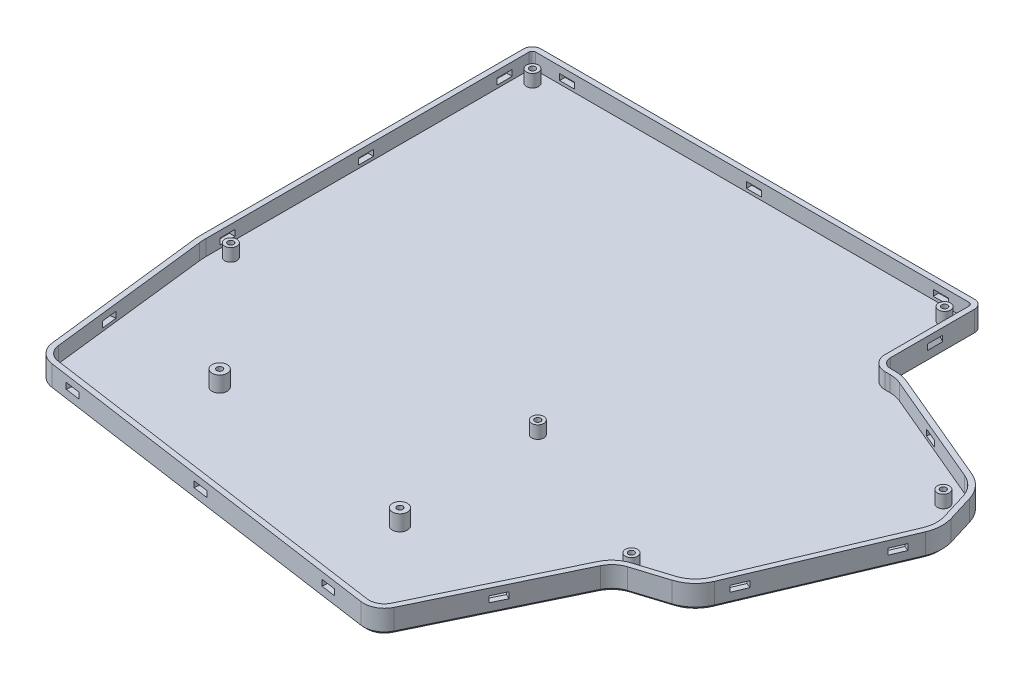
from build123d import *

# Parameters (mm, degrees)
EXTRUDE_1_DEPTH                 = 8
SHELL_1_T                       = -1.8
EXTRUDE_2_DEPTH                 = 2.8
CHAMFER_1_SIZE                  = 1.2
SKETCH_1_6_R                    = 2.5
EXTRUDE_3_DEPTH                 = 8
SKETCH_4_R                      = 2
EXTRUDE_4_DEPTH                 = 7
SKETCH_5_R                      = 2
CUT_EXTRUDE_2_DEPTH             = 1.8
SKETCH_6_R                      = 0.975
CUT_EXTRUDE_4_DEPTH             = 141.072245309
SKETCH_7_R                      = 0.975
CUT_EXTRUDE_5_DEPTH             = 5
OTHER_START                     = -73.595727744
OTHER_1_DEPTH                   = 5
OTHER_START_2                   = -23.595727744
OTHER_1_2_DEPTH                 = 5
OTHER_START_3                   = 26.404272256
OTHER_1_3_DEPTH                 = 5
OTHER_START_4                   = 37.760441006
OTHER_1_4_DEPTH                 = 5
OTHER_START_5                   = -85.913810652
OTHER_1_5_DEPTH                 = 5
OTHER_START_6                   = -80.913810652
OTHER_1_6_DEPTH                 = 5
OTHER_START_7                   = -39.913810652
OTHER_1_7_DEPTH                 = 5
OTHER_START_8                   = 6.086189348
OTHER_1_8_DEPTH                 = 5
OTHER_START_9                   = -92.32017293
OTHER_1_9_DEPTH                 = 5.004088406
OTHER_START_10                  = -30.32017293
OTHER_1_10_DEPTH                = 5.004088406
OTHER_START_11                  = 31.67982707
OTHER_1_11_DEPTH                = 5.004088406
OTHER_START_12                  = 45.029318989
OTHER_1_12_DEPTH                = 5
OTHER_START_13                  = 8.149122412
OTHER_1_13_DEPTH                = 5
OTHER_START_14                  = 48.149122412
OTHER_1_14_DEPTH                = 5
OTHER_START_15                  = -42.398480532
OTHER_1_15_DEPTH                = 5
CUT_EXTRUDE_1_REACH             = 229.09
SKETCH_6076_W                   = 5
SKETCH_6076_H                   = 2
CUT_EXTRUDE_1_DIRECTION_2_DEPTH = 228.090411107
CUT_EXTRUDE_2_2_REACH           = 234.851
SKETCH_9_W                      = 5
SKETCH_9_H                      = 2
CUT_EXTRUDE_3_REACH             = 218.543
SKETCH_10_W                     = 5
SKETCH_10_H                     = 2
CUT_EXTRUDE_4_2_REACH           = 211.505
SKETCH_11_W                     = 5
SKETCH_11_H                     = 2
CUT_EXTRUDE_5_2_REACH           = 225.549
SKETCH_12_W                     = 5
SKETCH_12_H                     = 2
CUT_EXTRUDE_6_REACH             = 213.991
SKETCH_13_W                     = 5
SKETCH_13_H                     = 2
CUT_EXTRUDE_7_REACH             = 217.265
SKETCH_14_W                     = 5.004088406
SKETCH_14_H                     = 2


# Read off the part's stored shape, not the designer's step: 型腔1
with BuildPart() as part:
    # 草图1 → 凸台-拉伸1 (new body)
    with BuildSketch(Plane(origin=(0, 0, 0), x_dir=(1, 0, 0), z_dir=(0, 1, 0))):
        with BuildLine():
            Line((-103.198547972, -15.620256198), (-103.198547972, 91.473161452))
            ThreePointArc((-103.198547972, 91.473161452), (-102.349157638, 93.523771117), (-100.298547972, 94.373161452))
            Line((-100.298547972, 94.373161452), (43.518152935, 94.373161452))
            ThreePointArc((43.518152935, 94.373161452), (45.5687626, 93.523771117), (46.418152935, 91.473161452))
            Line((46.418152935, 91.473161452), (46.418152935, 63.604205624))
            ThreePointArc((46.418152935, 63.604205624), (47.326121913, 61.412174602), (49.518152935, 60.504205624))
            Line((49.518152935, 60.504205624), (51.146615247, 60.504205624))
            ThreePointArc((51.146615247, 60.504205624), (53.506604914, 60.267843511), (55.772844642, 59.568146593))
            Line((55.772844642, 59.568146593), (93.262784098, 43.749285436))
            ThreePointArc((93.262784098, 43.749285436), (97.476797326, 40.751529899), (100.02124351, 36.249281642))
            Line((100.02124351, 36.249281642), (102.68323678, 27.50028781))
            ThreePointArc((102.68323678, 27.50028781), (103.182487219, 23.418298867), (102.262488942, 19.410121239))
            Line((102.262488942, 19.410121239), (81.487236613, -29.826226702))
            ThreePointArc((81.487236613, -29.826226702), (78.532968581, -34.000857461), (74.099321051, -36.549977144))
            Line((74.099321051, -36.549977144), (62.915226314, -40.073737319))
            ThreePointArc((62.915226314, -40.073737319), (60.047737989, -41.67537253), (58.051947414, -44.283924737))
            Line((58.051947414, -44.283924737), (35.803402586, -90.467786248))
            ThreePointArc((35.803402586, -90.467786248), (32.834391851, -93.561280846), (28.611436433, -94.303831252))
            Line((28.611436433, -94.303831252), (-91.020659667, -77.215820514))
            ThreePointArc((-91.020659667, -77.215820514), (-94.987916441, -75.199440178), (-96.898999439, -71.180400773))
            Line((-96.898999439, -71.180400773), (-103.052608483, -18.144310731))
            ThreePointArc((-103.052608483, -18.144310731), (-103.162032658, -16.88439124), (-103.198547972, -15.620256198))
        make_face()
    extrude(amount=EXTRUDE_1_DEPTH)

    # 抽壳1
    shell_1_openings = [part.faces().sort_by_distance(p)[0] for p in [
        (-12.989153161, 8, -5.543166959),
    ]]
    offset(amount=SHELL_1_T, openings=shell_1_openings, kind=Kind.INTERSECTION)

    # 草图1<5> → 凸台-拉伸2 (add)
    with BuildSketch(Plane(origin=(0, 0, 0), x_dir=(1, 0, 0), z_dir=(0, 1, 0))):
        with BuildLine():
            Line((-103.198547972, -15.620256198), (-103.198547972, 91.473161452))
            ThreePointArc((-103.198547972, 91.473161452), (-102.349157638, 93.523771117), (-100.298547972, 94.373161452))
            Line((-100.298547972, 94.373161452), (43.518152935, 94.373161452))
            ThreePointArc((43.518152935, 94.373161452), (45.5687626, 93.523771117), (46.418152935, 91.473161452))
            Line((46.418152935, 91.473161452), (46.418152935, 63.604205624))
            ThreePointArc((46.418152935, 63.604205624), (47.326121913, 61.412174602), (49.518152935, 60.504205624))
            Line((49.518152935, 60.504205624), (51.146615247, 60.504205624))
            ThreePointArc((51.146615247, 60.504205624), (53.506604914, 60.267843511), (55.772844642, 59.568146593))
            Line((55.772844642, 59.568146593), (93.262784098, 43.749285436))
            ThreePointArc((93.262784098, 43.749285436), (97.476797326, 40.751529899), (100.02124351, 36.249281642))
            Line((100.02124351, 36.249281642), (102.68323678, 27.50028781))
            ThreePointArc((102.68323678, 27.50028781), (103.182487219, 23.418298867), (102.262488942, 19.410121239))
            Line((102.262488942, 19.410121239), (81.487236613, -29.826226702))
            ThreePointArc((81.487236613, -29.826226702), (78.532968581, -34.000857461), (74.099321051, -36.549977144))
            Line((74.099321051, -36.549977144), (62.915226314, -40.073737319))
            ThreePointArc((62.915226314, -40.073737319), (60.047737989, -41.67537253), (58.051947414, -44.283924737))
            Line((58.051947414, -44.283924737), (35.803402586, -90.467786248))
            ThreePointArc((35.803402586, -90.467786248), (32.834391851, -93.561280846), (28.611436433, -94.303831252))
            Line((28.611436433, -94.303831252), (-91.020659667, -77.215820514))
            ThreePointArc((-91.020659667, -77.215820514), (-94.987916441, -75.199440178), (-96.898999439, -71.180400773))
            Line((-96.898999439, -71.180400773), (-103.052608483, -18.144310731))
            ThreePointArc((-103.052608483, -18.144310731), (-103.162032658, -16.88439124), (-103.198547972, -15.620256198))
        make_face()
    extrude(amount=EXTRUDE_2_DEPTH)

    # 倒角1
    chamfer_1_edges = [part.edges().sort_by_distance(p)[0] for p in [
        (46.927675, 0, 67.375855493),
        (60.047737989, 0, 41.67537253),
        (68.507273682, 0, 38.311857231),
        (101.352240145, 0, -31.874784726),
        (53.506604914, 0, -60.267843511),
        (46.418152935, 0, -77.538683538),
        (45.5687626, 0, -93.523771117),
        (-103.162032658, 0, 16.88439124),
        (32.834391851, 0, 93.561280846),
        (-99.975803961, 0, 44.662355752),
        (-94.987916441, 0, 75.199440178),
        (-31.204611617, 0, 85.759825883),
        (-103.198547972, 0, -37.926452627),
        (-102.349157638, 0, -93.523771117),
        (-28.390197519, 0, -94.373161452),
        (47.326121913, 0, -61.412174602),
        (50.332384091, 0, -60.504205624),
        (74.51781437, 0, -51.658716014),
        (97.476797326, 0, -40.751529899),
        (103.182487219, 0, -23.418298867),
        (91.874862778, 0, 5.208052732),
        (78.532968581, 0, 34.000857461),
    ]]
    chamfer(chamfer_1_edges, length=CHAMFER_1_SIZE)

    # 草图1<6> → 凸台-拉伸3 (add)
    with BuildSketch(Plane(origin=(0, 0, 0), x_dir=(1, 0, 0), z_dir=(0, 1, 0))):
        with Locations(Location((-61.66065098, -50.898976671, 0), (0, 0, 90))):
            Circle(SKETCH_1_6_R)
        with Locations(Location((8.133002281, -60.868163329, 0), (0, 0, 90))):
            Circle(SKETCH_1_6_R)
    extrude(amount=EXTRUDE_3_DEPTH)

    # 草图4 → 凸台-拉伸4 (add)
    with BuildSketch(Plane(origin=(0, 0, 0), x_dir=(1, 0, 0), z_dir=(0, 1, 0))):
        with Locations(Location((4.796495735, -11.776067612, 0), (0, 0, 90))):
            Circle(SKETCH_4_R)
        with Locations(Location((58.49137047, -34.404776747, 0), (0, 0, 90))):
            Circle(SKETCH_4_R)
        with Locations(Location((-97.077191421, -11.776067612, 0), (0, 0, 90))):
            Circle(SKETCH_4_R)
        with Locations(Location((-97.077191421, 88.328252795, 0), (0, 0, 90))):
            Circle(SKETCH_4_R)
        with Locations(Location((39.691476535, 88.328252795, 0), (0, 0, 90))):
            Circle(SKETCH_4_R)
        with Locations(Location((92.011556645, 35.568345732, 0), (0, 0, 90))):
            Circle(SKETCH_4_R)
    extrude(amount=EXTRUDE_4_DEPTH)

    # 草图5 → Cut-Extrude 2 (cut)
    with BuildSketch(Plane(origin=(0, 0, 0), x_dir=(1, 0, 0), z_dir=(0, 1, 0))):
        with Locations(Location((-61.66065098, -50.898976671, 0), (0, 0, 270))):
            Circle(SKETCH_5_R)
        with Locations(Location((8.133002281, -60.868163329, 0), (0, 0, 270))):
            Circle(SKETCH_5_R)
    extrude(amount=CUT_EXTRUDE_2_DEPTH, mode=Mode.SUBTRACT)

    # 草图6 → Cut-Extrude 4 (cut, through all)
    with BuildSketch(Plane(origin=(0, 8, 0), x_dir=(1, 0, 0), z_dir=(0, 1, 0))):
        with Locations(Location((8.133002281, -60.868163329, 0), (0, 0, 270))):
            Circle(SKETCH_6_R)
        with Locations(Location((-61.66065098, -50.898976671, 0), (0, 0, 270))):
            Circle(SKETCH_6_R)
    extrude(amount=-CUT_EXTRUDE_4_DEPTH, mode=Mode.SUBTRACT)

    # 草图7 → Cut-Extrude 5 (cut)
    with BuildSketch(Plane(origin=(0, 7, 0), x_dir=(1, 0, 0), z_dir=(0, 1, 0))):
        with Locations(Location((-97.077191421, -11.776067612, 0), (0, 0, 270))):
            Circle(SKETCH_7_R)
        with Locations(Location((4.796495735, -11.776067612, 0), (0, 0, 270))):
            Circle(SKETCH_7_R)
        with Locations(Location((58.49137047, -34.404776747, 0), (0, 0, 270))):
            Circle(SKETCH_7_R)
        with Locations(Location((92.011556645, 35.568345732, 0), (0, 0, 270))):
            Circle(SKETCH_7_R)
        with Locations(Location((39.691476535, 88.328252795, 0), (0, 0, 270))):
            Circle(SKETCH_7_R)
        with Locations(Location((-97.077191421, 88.328252795, 0), (0, 0, 270))):
            Circle(SKETCH_7_R)
    extrude(amount=-CUT_EXTRUDE_5_DEPTH, mode=Mode.SUBTRACT)

    # 型腔1 outline → 型腔1 (cut)
    with BuildSketch(Plane(origin=(0, 0, 0), x_dir=(0, 1, 0), z_dir=(0.9899521449428842, 0, 0.14140279602250802)).offset(OTHER_START)):
        with BuildLine():
            ThreePointArc((5.312591486, 88.200469726), (5.629956619, 88.164339398), (5.8, 88.434730369))
            Line((5.8, 88.434730369), (5.8, 89.310542914))
            Line((5.8, 89.310542914), (3.925, 89.310542914))
            Line((3.925, 89.310542914), (5.312591486, 88.200469726))
        make_face()
    extrude(amount=OTHER_1_DEPTH, mode=Mode.SUBTRACT)

    # Other 1 2 outline → Other 1 2 (cut)
    with BuildSketch(Plane(origin=(0, 0, 0), x_dir=(0, 1, 0), z_dir=(0.9899521449428842, 0, 0.14140279602250802)).offset(OTHER_START_2)):
        with BuildLine():
            ThreePointArc((5.312591486, 88.200469726), (5.629956619, 88.164339398), (5.8, 88.434730369))
            Line((5.8, 88.434730369), (5.8, 89.310542914))
            Line((5.8, 89.310542914), (3.925, 89.310542914))
            Line((3.925, 89.310542914), (5.312591486, 88.200469726))
        make_face()
    extrude(amount=OTHER_1_2_DEPTH, mode=Mode.SUBTRACT)

    # Other 1 3 outline → Other 1 3 (cut)
    with BuildSketch(Plane(origin=(0, 0, 0), x_dir=(0, 1, 0), z_dir=(0.9899521449428842, 0, 0.14140279602250802)).offset(OTHER_START_3)):
        with BuildLine():
            ThreePointArc((5.312591486, 88.200469726), (5.629956619, 88.164339398), (5.8, 88.434730369))
            Line((5.8, 88.434730369), (5.8, 89.310542914))
            Line((5.8, 89.310542914), (3.925, 89.310542914))
            Line((3.925, 89.310542914), (5.312591486, 88.200469726))
        make_face()
    extrude(amount=OTHER_1_3_DEPTH, mode=Mode.SUBTRACT)

    # Other 1 4 outline → Other 1 4 (cut)
    with BuildSketch(Plane(origin=(0, 0, 0), x_dir=(0.9933360963882286, 0, -0.11525363166597408), z_dir=(0.11525363166597406, 0, 0.9933360963882285)).offset(OTHER_START_4)):
        with BuildLine():
            Line((-103.581260994, 5.8), (-104.457073539, 5.8))
            Line((-104.457073539, 5.8), (-104.457073539, 3.925))
            Line((-104.457073539, 3.925), (-103.347000351, 5.312591486))
            ThreePointArc((-103.347000351, 5.312591486), (-103.310870023, 5.629956619), (-103.581260994, 5.8))
        make_face()
    extrude(amount=OTHER_1_4_DEPTH, mode=Mode.SUBTRACT)

    # Other 1 5 outline → Other 1 5 (cut)
    with BuildSketch(Plane.XY.offset(OTHER_START_5)):
        with BuildLine():
            Line((-102.322735427, 5.8), (-103.198547972, 5.8))
            Line((-103.198547972, 5.8), (-103.198547972, 3.925))
            Line((-103.198547972, 3.925), (-102.088474784, 5.312591486))
            ThreePointArc((-102.088474784, 5.312591486), (-102.052344456, 5.629956619), (-102.322735427, 5.8))
        make_face()
    extrude(amount=OTHER_1_5_DEPTH, mode=Mode.SUBTRACT)

    # Other 1 6 outline → Other 1 6 (cut)
    with BuildSketch(Plane.XY.offset(OTHER_START_6)):
        with BuildLine():
            Line((46.418152935, 5.8), (45.542340389, 5.8))
            ThreePointArc((45.542340389, 5.8), (45.271949418, 5.629956619), (45.308079746, 5.312591486))
            Line((45.308079746, 5.312591486), (46.418152935, 3.925))
            Line((46.418152935, 3.925), (46.418152935, 5.8))
        make_face()
    extrude(amount=OTHER_1_6_DEPTH, mode=Mode.SUBTRACT)

    # Other 1 7 outline → Other 1 7 (cut)
    with BuildSketch(Plane.XY.offset(OTHER_START_7)):
        with BuildLine():
            Line((-102.322735427, 5.8), (-103.198547972, 5.8))
            Line((-103.198547972, 5.8), (-103.198547972, 3.925))
            Line((-103.198547972, 3.925), (-102.088474784, 5.312591486))
            ThreePointArc((-102.088474784, 5.312591486), (-102.052344456, 5.629956619), (-102.322735427, 5.8))
        make_face()
    extrude(amount=OTHER_1_7_DEPTH, mode=Mode.SUBTRACT)

    # Other 1 8 outline → Other 1 8 (cut)
    with BuildSketch(Plane.XY.offset(OTHER_START_8)):
        with BuildLine():
            Line((-102.322735427, 5.8), (-103.198547972, 5.8))
            Line((-103.198547972, 5.8), (-103.198547972, 3.925))
            Line((-103.198547972, 3.925), (-102.088474784, 5.312591486))
            ThreePointArc((-102.088474784, 5.312591486), (-102.052344456, 5.629956619), (-102.322735427, 5.8))
        make_face()
    extrude(amount=OTHER_1_8_DEPTH, mode=Mode.SUBTRACT)

    # Other 1 9 outline → Other 1 9 (cut)
    with BuildSketch(Plane.YZ.offset(OTHER_START_9)):
        with BuildLine():
            Line((5.8, -94.373161452), (5.8, -93.497348906))
            ThreePointArc((5.8, -93.497348906), (5.629956619, -93.226957935), (5.312591486, -93.263088263))
            Line((5.312591486, -93.263088263), (3.925, -94.373161452))
            Line((3.925, -94.373161452), (5.8, -94.373161452))
        make_face()
    extrude(amount=OTHER_1_9_DEPTH, mode=Mode.SUBTRACT)

    # Other 1 10 outline → Other 1 10 (cut)
    with BuildSketch(Plane.YZ.offset(OTHER_START_10)):
        with BuildLine():
            Line((5.8, -94.373161452), (5.8, -93.497348906))
            ThreePointArc((5.8, -93.497348906), (5.629956619, -93.226957935), (5.312591486, -93.263088263))
            Line((5.312591486, -93.263088263), (3.925, -94.373161452))
            Line((3.925, -94.373161452), (5.8, -94.373161452))
        make_face()
    extrude(amount=OTHER_1_10_DEPTH, mode=Mode.SUBTRACT)

    # Other 1 11 outline → Other 1 11 (cut)
    with BuildSketch(Plane.YZ.offset(OTHER_START_11)):
        with BuildLine():
            Line((5.8, -94.373161452), (5.8, -93.497348906))
            ThreePointArc((5.8, -93.497348906), (5.629956619, -93.226957935), (5.312591486, -93.263088263))
            Line((5.312591486, -93.263088263), (3.925, -94.373161452))
            Line((3.925, -94.373161452), (5.8, -94.373161452))
        make_face()
    extrude(amount=OTHER_1_11_DEPTH, mode=Mode.SUBTRACT)

    # Other 1 12 outline → Other 1 12 (cut)
    with BuildSketch(Plane(origin=(0, 0, 0), x_dir=(0, 1, 0), z_dir=(0.92133957727179, 0, 0.388758772701838)).offset(OTHER_START_12)):
        with BuildLine():
            Line((5.8, -76.564673634), (5.8, -75.688861088))
            ThreePointArc((5.8, -75.688861088), (5.629956619, -75.418470117), (5.312591486, -75.454600445))
            Line((5.312591486, -75.454600445), (3.925, -76.564673634))
            Line((3.925, -76.564673634), (5.8, -76.564673634))
        make_face()
    extrude(amount=OTHER_1_12_DEPTH, mode=Mode.SUBTRACT)

    # Other 1 13 outline → Other 1 13 (cut)
    with BuildSketch(Plane(origin=(0, 0, 0), x_dir=(0.9213395772717908, 0, 0.388758772701836), z_dir=(0.38875877270183595, 0, -0.9213395772717909)).offset(OTHER_START_13)):
        with BuildLine():
            Line((85.796810876, -5.8), (86.672623422, -5.8))
            Line((86.672623422, -5.8), (86.672623422, -3.925))
            Line((86.672623422, -3.925), (85.562550233, -5.312591486))
            ThreePointArc((85.562550233, -5.312591486), (85.526419905, -5.629956619), (85.796810876, -5.8))
        make_face()
    extrude(amount=OTHER_1_13_DEPTH, mode=Mode.SUBTRACT)

    # Other 1 14 outline → Other 1 14 (cut)
    with BuildSketch(Plane(origin=(0, 0, 0), x_dir=(0.9213395772717908, 0, 0.388758772701836), z_dir=(0.38875877270183595, 0, -0.9213395772717909)).offset(OTHER_START_14)):
        with BuildLine():
            Line((85.796810876, -5.8), (86.672623422, -5.8))
            Line((86.672623422, -5.8), (86.672623422, -3.925))
            Line((86.672623422, -3.925), (85.562550233, -5.312591486))
            ThreePointArc((85.562550233, -5.312591486), (85.526419905, -5.629956619), (85.796810876, -5.8))
        make_face()
    extrude(amount=OTHER_1_14_DEPTH, mode=Mode.SUBTRACT)

    # Other 1 15 outline → Other 1 15 (cut)
    with BuildSketch(Plane(origin=(0, 0, 0), x_dir=(0.9009111391652838, 0, 0.43400359368087105), z_dir=(0.434003593680871, 0, -0.900911139165284)).offset(OTHER_START_15)):
        with BuildLine():
            Line((70.643216008, -5.8), (71.519028554, -5.8))
            Line((71.519028554, -5.8), (71.519028554, -3.925))
            Line((71.519028554, -3.925), (70.408955365, -5.312591486))
            ThreePointArc((70.408955365, -5.312591486), (70.372825037, -5.629956619), (70.643216008, -5.8))
        make_face()
    extrude(amount=OTHER_1_15_DEPTH, mode=Mode.SUBTRACT)

    # Sketch 6076 → 卡扣槽1 (cut, up to next)
    with BuildSketch(Plane.ZY.offset(103.198547972), mode=Mode.PRIVATE) as cut_extrude_1_sk1:
        with Locations((-83.413810652, 4.8)):
            Rectangle(SKETCH_6076_W, SKETCH_6076_H)
    cut_extrude_1_tool1 = extrude(cut_extrude_1_sk1.sketch, amount=-CUT_EXTRUDE_1_REACH, mode=Mode.PRIVATE) & part.part
    # Sketch 6076 → 卡扣槽1 (cut, up to next)
    with BuildSketch(Plane.ZY.offset(103.198547972), mode=Mode.PRIVATE) as cut_extrude_1_sk2:
        with Locations((-37.413810652, 4.8)):
            Rectangle(SKETCH_6076_W, SKETCH_6076_H)
    cut_extrude_1_tool2 = extrude(cut_extrude_1_sk2.sketch, amount=-CUT_EXTRUDE_1_REACH, mode=Mode.PRIVATE) & part.part
    # Sketch 6076 → 卡扣槽1 (cut, up to next)
    with BuildSketch(Plane.ZY.offset(103.198547972), mode=Mode.PRIVATE) as cut_extrude_1_sk3:
        with Locations((8.586189348, 4.8)):
            Rectangle(SKETCH_6076_W, SKETCH_6076_H)
    cut_extrude_1_tool3 = extrude(cut_extrude_1_sk3.sketch, amount=-CUT_EXTRUDE_1_REACH, mode=Mode.PRIVATE) & part.part
    add(cut_extrude_1_tool1.solids().sort_by_distance((-103.198548, 4.8, -83.413811))[0], mode=Mode.SUBTRACT)
    add(cut_extrude_1_tool2.solids().sort_by_distance((-103.198548, 4.8, -37.413811))[0], mode=Mode.SUBTRACT)
    add(cut_extrude_1_tool3.solids().sort_by_distance((-103.198548, 4.8, 8.586189))[0], mode=Mode.SUBTRACT)

    # Sketch 6076 → 卡扣槽1 direction 2 (cut)
    with BuildSketch(Plane.ZY.offset(103.198547972)):
        with Locations((-83.413810652, 4.8)):
            Rectangle(SKETCH_6076_W, SKETCH_6076_H)
        with Locations((-37.413810652, 4.8)):
            Rectangle(SKETCH_6076_W, SKETCH_6076_H)
        with Locations((8.586189348, 4.8)):
            Rectangle(SKETCH_6076_W, SKETCH_6076_H)
    extrude(amount=CUT_EXTRUDE_1_DIRECTION_2_DEPTH, mode=Mode.SUBTRACT)

    # 草图9 → Cut-Extrude 2 2 (cut, up to next)
    with BuildSketch(Plane(origin=(-103.76098167, 0, 12.039057079), x_dir=(0.11525363166597431, 0, 0.9933360963882285), z_dir=(-0.9933360963882285, 0, 0.11525363166597431)), mode=Mode.PRIVATE) as cut_extrude_2_2_sk1:
        with Locations((40.260441006, 4.8)):
            Rectangle(SKETCH_9_W, SKETCH_9_H)
    cut_extrude_2_2_tool1 = extrude(cut_extrude_2_2_sk1.sketch, amount=-CUT_EXTRUDE_2_2_REACH, mode=Mode.PRIVATE) & part.part
    add(cut_extrude_2_2_tool1.solids().sort_by_distance((-99.12082, 4.8, 52.031206))[0], mode=Mode.SUBTRACT)

    # 草图10 → 卡扣槽3 (cut, up to next)
    with BuildSketch(Plane(origin=(-12.628760482, 0, 88.413163524), x_dir=(0.9899521449428836, 0, 0.1414027960225113), z_dir=(-0.1414027960225113, 0, 0.9899521449428836)), mode=Mode.PRIVATE) as cut_extrude_3_sk1:
        with Locations((-71.095727744, 4.8)):
            Rectangle(SKETCH_10_W, SKETCH_10_H)
    cut_extrude_3_tool1 = extrude(cut_extrude_3_sk1.sketch, amount=-CUT_EXTRUDE_3_REACH, mode=Mode.PRIVATE) & part.part
    # 草图10 → 卡扣槽3 (cut, up to next)
    with BuildSketch(Plane(origin=(-12.628760482, 0, 88.413163524), x_dir=(0.9899521449428836, 0, 0.1414027960225113), z_dir=(-0.1414027960225113, 0, 0.9899521449428836)), mode=Mode.PRIVATE) as cut_extrude_3_sk2:
        with Locations((-21.095727744, 4.8)):
            Rectangle(SKETCH_10_W, SKETCH_10_H)
    cut_extrude_3_tool2 = extrude(cut_extrude_3_sk2.sketch, amount=-CUT_EXTRUDE_3_REACH, mode=Mode.PRIVATE) & part.part
    # 草图10 → 卡扣槽3 (cut, up to next)
    with BuildSketch(Plane(origin=(-12.628760482, 0, 88.413163524), x_dir=(0.9899521449428836, 0, 0.1414027960225113), z_dir=(-0.1414027960225113, 0, 0.9899521449428836)), mode=Mode.PRIVATE) as cut_extrude_3_sk3:
        with Locations((28.904272256, 4.8)):
            Rectangle(SKETCH_10_W, SKETCH_10_H)
    cut_extrude_3_tool3 = extrude(cut_extrude_3_sk3.sketch, amount=-CUT_EXTRUDE_3_REACH, mode=Mode.PRIVATE) & part.part
    add(cut_extrude_3_tool1.solids().sort_by_distance((-83.010129, 4.8, 78.360029))[0], mode=Mode.SUBTRACT)
    add(cut_extrude_3_tool2.solids().sort_by_distance((-33.512521, 4.8, 85.430169))[0], mode=Mode.SUBTRACT)
    add(cut_extrude_3_tool3.solids().sort_by_distance((15.985086, 4.8, 92.500308))[0], mode=Mode.SUBTRACT)

    # 草图11 → Cut-Extrude 4 2 (cut, up to next)
    with BuildSketch(Plane(origin=(64.432289486, 0, 31.039515409), x_dir=(0.43400359368087543, 0, -0.9009111391652818), z_dir=(0.9009111391652818, 0, 0.43400359368087543)), mode=Mode.PRIVATE) as cut_extrude_4_2_sk1:
        with Locations((-39.898480532, 4.8)):
            Rectangle(SKETCH_11_W, SKETCH_11_H)
    cut_extrude_4_2_tool1 = extrude(cut_extrude_4_2_sk1.sketch, amount=-CUT_EXTRUDE_4_2_REACH, mode=Mode.PRIVATE) & part.part
    add(cut_extrude_4_2_tool1.solids().sort_by_distance((47.116206, 4.8, 66.984501))[0], mode=Mode.SUBTRACT)

    # 草图12 → Cut-Extrude 5 2 (cut, up to next)
    with BuildSketch(Plane(origin=(79.854918224, 0, 33.694742708), x_dir=(0.38875877270183823, 0, -0.92133957727179), z_dir=(0.9213395772717898, 0, 0.3887587727018382)), mode=Mode.PRIVATE) as cut_extrude_5_2_sk1:
        with Locations((10.649122412, 4.8)):
            Rectangle(SKETCH_12_W, SKETCH_12_H)
    cut_extrude_5_2_tool1 = extrude(cut_extrude_5_2_sk1.sketch, amount=-CUT_EXTRUDE_5_2_REACH, mode=Mode.PRIVATE) & part.part
    # 草图12 → Cut-Extrude 5 2 (cut, up to next)
    with BuildSketch(Plane(origin=(79.854918224, 0, 33.694742708), x_dir=(0.38875877270183823, 0, -0.92133957727179), z_dir=(0.9213395772717898, 0, 0.3887587727018382)), mode=Mode.PRIVATE) as cut_extrude_5_2_sk2:
        with Locations((50.649122412, 4.8)):
            Rectangle(SKETCH_12_W, SKETCH_12_H)
    cut_extrude_5_2_tool2 = extrude(cut_extrude_5_2_sk2.sketch, amount=-CUT_EXTRUDE_5_2_REACH, mode=Mode.PRIVATE) & part.part
    add(cut_extrude_5_2_tool1.solids().sort_by_distance((83.994858, 4.8, 23.883285))[0], mode=Mode.SUBTRACT)
    add(cut_extrude_5_2_tool2.solids().sort_by_distance((99.545209, 4.8, -12.970298))[0], mode=Mode.SUBTRACT)

    # 草图13 → 卡扣槽6 (cut, up to next)
    with BuildSketch(Plane(origin=(29.765188554, 0, -70.54206404), x_dir=(-0.9213395772717896, 0, -0.388758772701839), z_dir=(0.388758772701839, 0, -0.9213395772717896)), mode=Mode.PRIVATE) as cut_extrude_6_sk1:
        with Locations((-47.529318989, 4.8)):
            Rectangle(SKETCH_13_W, SKETCH_13_H)
    cut_extrude_6_tool1 = extrude(cut_extrude_6_sk1.sketch, amount=-CUT_EXTRUDE_6_REACH, mode=Mode.PRIVATE) & part.part
    add(cut_extrude_6_tool1.solids().sort_by_distance((73.555831, 4.8, -52.064624))[0], mode=Mode.SUBTRACT)

    # 草图14 → 卡扣槽7 (cut, up to next)
    with BuildSketch(Plane(origin=(0, 0, -94.373161452), x_dir=(-1, 0, 0), z_dir=(0, 0, -1)), mode=Mode.PRIVATE) as cut_extrude_7_sk1:
        with Locations((89.818128727, 4.8)):
            Rectangle(SKETCH_14_W, SKETCH_14_H)
    cut_extrude_7_tool1 = extrude(cut_extrude_7_sk1.sketch, amount=-CUT_EXTRUDE_7_REACH, mode=Mode.PRIVATE) & part.part
    # 草图14 → 卡扣槽7 (cut, up to next)
    with BuildSketch(Plane(origin=(0, 0, -94.373161452), x_dir=(-1, 0, 0), z_dir=(0, 0, -1)), mode=Mode.PRIVATE) as cut_extrude_7_sk2:
        with Locations((-34.181871273, 4.8)):
            Rectangle(SKETCH_14_W, SKETCH_14_H)
    cut_extrude_7_tool2 = extrude(cut_extrude_7_sk2.sketch, amount=-CUT_EXTRUDE_7_REACH, mode=Mode.PRIVATE) & part.part
    # 草图14 → 卡扣槽7 (cut, up to next)
    with BuildSketch(Plane(origin=(0, 0, -94.373161452), x_dir=(-1, 0, 0), z_dir=(0, 0, -1)), mode=Mode.PRIVATE) as cut_extrude_7_sk3:
        with Locations((27.818128727, 4.8)):
            Rectangle(SKETCH_14_W, SKETCH_14_H)
    cut_extrude_7_tool3 = extrude(cut_extrude_7_sk3.sketch, amount=-CUT_EXTRUDE_7_REACH, mode=Mode.PRIVATE) & part.part
    add(cut_extrude_7_tool1.solids().sort_by_distance((-89.818129, 4.8, -94.373161))[0], mode=Mode.SUBTRACT)
    add(cut_extrude_7_tool2.solids().sort_by_distance((34.181871, 4.8, -94.373161))[0], mode=Mode.SUBTRACT)
    add(cut_extrude_7_tool3.solids().sort_by_distance((-27.818129, 4.8, -94.373161))[0], mode=Mode.SUBTRACT)


solid = part.part
